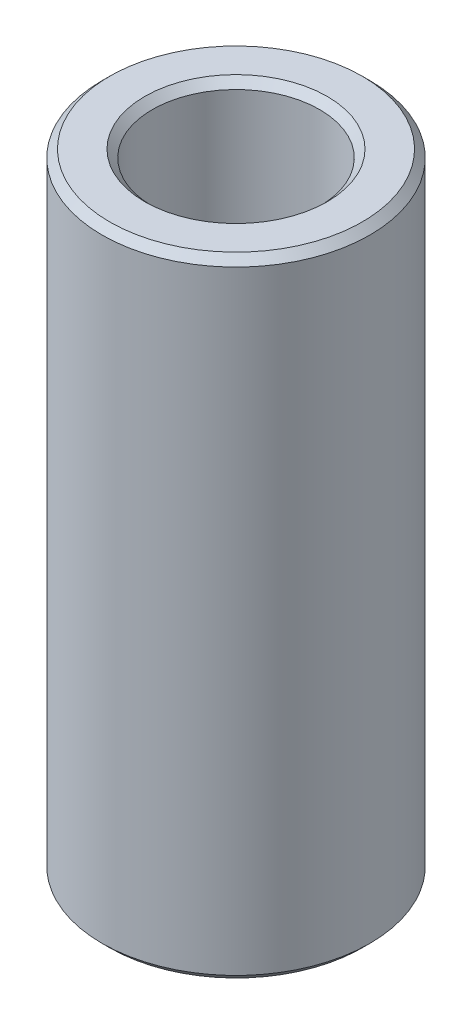
from build123d import *

# Parameters (mm, degrees)
SKETCH1_R           = 37.5
BOSS_EXTRUDE1_DEPTH = 176.118679991
SKETCH2_R           = 23.440066306
CUT_EXTRUDE1_DEPTH  = 184.930121084
CHAMFER1_SIZE       = 2.124090295


with BuildPart() as part:
    # Sketch1 → Boss-Extrude1 (new body)
    with BuildSketch(Plane(origin=(0, 0, 0), x_dir=(1, 0, 0), z_dir=(0, 1, 0))):
        Circle(SKETCH1_R)
    extrude(amount=BOSS_EXTRUDE1_DEPTH)

    # Sketch2 → Cut-Extrude1 (cut, through all)
    with BuildSketch(Plane(origin=(0, 0, 0), x_dir=(1, 0, 0), z_dir=(0, 1, 0))):
        Circle(SKETCH2_R)
    extrude(amount=CUT_EXTRUDE1_DEPTH, mode=Mode.SUBTRACT)

    # Chamfer1
    chamfer1_edges = [part.edges().sort_by_distance(p)[0] for p in [
        (-23.440066306, 176.118679991, 0),
        (-23.440066306, 0, 0),
        (-37.5, 0, 0),
        (-37.5, 176.118679991, 0),
    ]]
    chamfer(chamfer1_edges, length=CHAMFER1_SIZE)


solid = part.part
